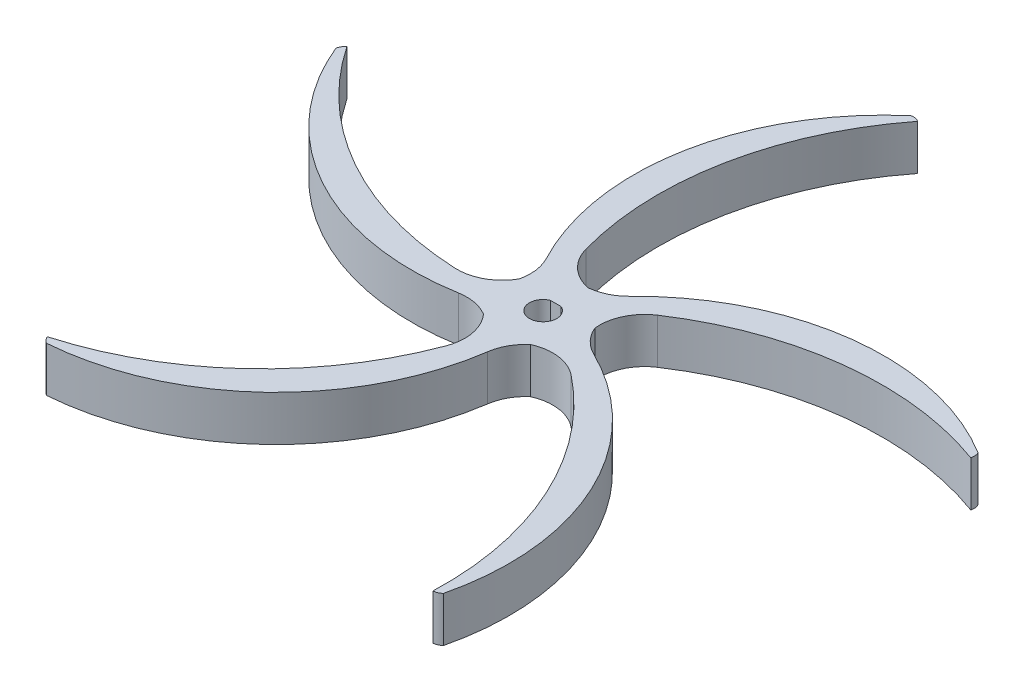
from build123d import *

# Parameters (mm, degrees)
BOSS_EXTRUDE4_DEPTH = 10
SKETCH5_R           = 1.6210620194390177
BOSS_EXTRUDE8_DEPTH = 10
CIRPATTERN4_COUNT   = 5
SKETCH6_R           = 9.321133181207394
BOSS_EXTRUDE9_DEPTH = 10
CUT_EXTRUDE1_DEPTH  = 10
FILLET1_R           = 10


with BuildPart() as part:
    # Sketch3 → Boss-Extrude4 (new body)
    with BuildSketch(Plane(origin=(0, 0, 0), x_dir=(1, 0, 0), z_dir=(0, 1, 0))):
        with BuildLine():
            ThreePointArc((-2.568584889231257, 0), (-15.859987880186992, 40.28882096120527), (3.4054490784254314, 78.086882111293))
            ThreePointArc((3.4054490784254314, 78.086882111293), (4.310285634950187, 78.05431633363062), (5.144295315107662, 77.70187119279029))
            ThreePointArc((5.144295315107662, 77.70187119279029), (-9.176823691930053, 42.2861657946719), (-2.568584889231257, 4.660405757344381))
            ThreePointArc((-2.568584889231257, 4.660405757344381), (-2.7066052458532077, 2.3302028786721882), (-2.568584889231257, 0))
        make_face()
    extrude(amount=BOSS_EXTRUDE4_DEPTH)


with BuildPart() as body_2:
    # Sketch5 → Boss-Extrude8 (new body)
    with BuildSketch(Plane(origin=(0, 0, 0), x_dir=(1, 0, 0), z_dir=(0, 1, 0))):
        with Locations(Location((0, 0, 0), (0, 0, 270))):
            Circle(SKETCH5_R)
    extrude(amount=BOSS_EXTRUDE8_DEPTH)


with BuildPart() as cirpattern4_1:
    # CirPattern4: pattern copy
    add(part.part.rotate(Axis((-3.4e-16, 0, -5.8e-16), (0, 1, 0)), 1 * 360 / CIRPATTERN4_COUNT))


with BuildPart() as cirpattern4_2:
    # CirPattern4: pattern copy
    add(part.part.rotate(Axis((-3.4e-16, 0, -5.8e-16), (0, 1, 0)), 2 * 360 / CIRPATTERN4_COUNT))


with BuildPart() as cirpattern4_3:
    # CirPattern4: pattern copy
    add(part.part.rotate(Axis((-3.4e-16, 0, -5.8e-16), (0, 1, 0)), 3 * 360 / CIRPATTERN4_COUNT))


with BuildPart() as cirpattern4_4:
    # CirPattern4: pattern copy
    add(part.part.rotate(Axis((-3.4e-16, 0, -5.8e-16), (0, 1, 0)), 4 * 360 / CIRPATTERN4_COUNT))


with BuildPart() as part_1:
    add(part.part)

    add(body_2.part)  # Boss-Extrude9 merges body 2

    add(cirpattern4_1.part)  # Boss-Extrude9 merges CirPattern4_1

    add(cirpattern4_2.part)  # Boss-Extrude9 merges CirPattern4_2

    add(cirpattern4_3.part)  # Boss-Extrude9 merges CirPattern4_3

    add(cirpattern4_4.part)  # Boss-Extrude9 merges CirPattern4_4
    # Sketch6 → Boss-Extrude9 (add)
    with BuildSketch(Plane(origin=(0, 10, 0), x_dir=(1, 0, 0), z_dir=(0, 1, 0))):
        Circle(SKETCH6_R)
    extrude(amount=-BOSS_EXTRUDE9_DEPTH)

    # Sketch7 → Cut-Extrude1 (cut)
    with BuildSketch(Plane(origin=(0, 10, 0), x_dir=(1, 0, 0), z_dir=(0, 1, 0))):
        with BuildLine():
            Line((1.1925707526180573, 2.78), (-1.1925707526180573, 2.78))
            ThreePointArc((-1.1925707526180578, 2.78), (-1.6647970556993392, -2.5256832270367577), (3.025, -7.4e-16))
            ThreePointArc((3.025, 0), (2.5256832270367577, 1.6647970556993388), (1.1925707526180576, 2.78))
        make_face()
    extrude(amount=-CUT_EXTRUDE1_DEPTH, mode=Mode.SUBTRACT)

    # Fillet1
    # the kernel refuses this fillet: 10 mm, written as the material it adds along each edge
    with BuildSketch(Plane(origin=(9.294704214468556, 10, 0.7014252257691618), x_dir=(0.9166930954116449, 0, 0.399592002953784), z_dir=(0, -1, 0))) as fillet1_piece_1:
        with BuildLine():
            CenterArc((5.437298438361188, -9.98977111966082), FILLET1_R, 92.59172373372462, 44.87729573930281)
            ThreePointArc((-1.9318208534579913, -3.2298834828033556), (-0.8012017224871335, -1.713455421939968), (0, 0))
            ThreePointArc((0, 0), (2.4925557778833074, -0.0563838885471548), (4.985111555766614, 2e-17))
        make_face()
    extrude(amount=10)
    with BuildSketch(Plane(origin=(6.60253368503394, 10, -6.579519186065028), x_dir=(0.46308073985482195, 0, 0.8863160995804548), z_dir=(0, -1, 0))) as fillet1_piece_2:
        with BuildLine():
            CenterArc((8.524117810925986, -9.546886996079968), FILLET1_R, 107.3138862206167, 66.77214806671216)
            ThreePointArc((-1.4226595103454045, -8.516537093842318), (-0.8440182810230222, -4.236103365094945), (0, 0))
            ThreePointArc((0, 0), (2.774027598326007, -0.42235266556755513), (5.548055196652016, 2e-17))
        make_face()
    extrude(amount=10)
    with BuildSketch(Plane(origin=(-4.2171994813875955, 10, -8.31256592851991), x_dir=(-0.3267162956046077, 0, -0.9451224588308135), z_dir=(0, -1, 0))) as fillet1_piece_3:
        with BuildLine():
            CenterArc((8.011945209416133, 9.980599667944867), FILLET1_R, 206.79739354469726, 66.7721480667119)
            ThreePointArc((-0.9141180755940358, 5.47223031395517), (-0.04047863659748981, 2.805703542850818), (0, 0))
            ThreePointArc((0, 0), (4.317272407237243, -0.13452709830263468), (8.634544814474475, -3.1e-16))
        make_face()
    extrude(amount=10)
    with BuildSketch(Plane(origin=(3.539316591620801, 10, -8.623036695160394), x_dir=(-0.9827141698360341, 0, -0.18512930725164625), z_dir=(0, -1, 0))) as fillet1_piece_4:
        with BuildLine():
            CenterArc((5.782329586263011, 9.794100565483701), FILLET1_R, 213.47572744282695, 44.87729573930915)
            ThreePointArc((-2.5588660900526423, 4.278263848410483), (-1.2310439268876425, 2.1680738683956533), (0, 0))
            ThreePointArc((0, 0), (1.881759756341037, 0.19192160510617215), (3.7635195126820715, -5e-17))
        make_face()
    extrude(amount=10)
    with BuildSketch(Plane(origin=(-9.208906301869895, 10, 1.4420709085153902), x_dir=(-0.9998257608489958, 0, 0.018666760370418967), z_dir=(0, -1, 0))) as fillet1_piece_5:
        with BuildLine():
            CenterArc((8.011945209416153, 9.980599667944865), FILLET1_R, 206.79739354469731, 66.7721480667119)
            ThreePointArc((-0.9141180755940117, 5.472230313955157), (-0.04047863659747148, 2.8057035428508104), (0, 0))
            ThreePointArc((0, 0), (4.317272407237252, -0.13452709830265147), (8.634544814474507, -2e-17))
        make_face()
    extrude(amount=10)
    with BuildSketch(Plane(origin=(-7.1072862639004715, 10, -6.030754989615849), x_dir=(-0.47974381311129005, 0, 0.8774086127805217), z_dir=(0, -1, 0))) as fillet1_piece_6:
        with BuildLine():
            CenterArc((5.782329586263038, 9.794100565483692), FILLET1_R, 213.47572744282687, 44.877295739309034)
            ThreePointArc((-2.5588660900526223, 4.278263848410486), (-1.2310439268876405, 2.168073868395652), (0, 0))
            ThreePointArc((0, 0), (1.8817597563410384, 0.19192160510617853), (3.763519512682072, -7e-17))
        make_face()
    extrude(amount=10)
    with BuildSketch(Plane(origin=(-7.931861070486542, 10, 4.895825133754791), x_dir=(-0.9764945790844407, 0, 0.21554196115536567), z_dir=(0, -1, 0))) as fillet1_piece_7:
        with BuildLine():
            CenterArc((5.43729843836118, -9.989771119660821), FILLET1_R, 92.59172373372459, 44.877295739302724)
            ThreePointArc((-1.9318208534579884, -3.2298834828033454), (-0.801201722487141, -1.7134554219399574), (0, 0))
            ThreePointArc((0, 0), (2.492555777883305, -0.05638388854715234), (4.985111555766614, 5e-17))
        make_face()
    extrude(amount=10)
    with BuildSketch(Plane(origin=(-1.4742176123811461, 10, 9.203814764169852), x_dir=(-0.8956037205130516, 0, -0.44485275744135816), z_dir=(0, -1, 0))) as fillet1_piece_8:
        with BuildLine():
            CenterArc((8.524117810925947, -9.546886996079973), FILLET1_R, 107.31388622061658, 66.77214806671205)
            ThreePointArc((-1.422659510345439, -8.516537093842285), (-0.8440182810230522, -4.236103365094935), (0, 0))
            ThreePointArc((0, 0), (2.774027598325997, -0.42235266556755147), (5.548055196651995, 2.3e-16))
        make_face()
    extrude(amount=10)
    with BuildSketch(Plane(origin=(2.2051265282976815, 10, 9.056541325252308), x_dir=(-0.0967608331602571, 0, 0.9953076615630632), z_dir=(0, -1, 0))) as fillet1_piece_9:
        with BuildLine():
            CenterArc((5.437298438361169, -9.989771119660823), FILLET1_R, 92.59172373372452, 44.87729573930274)
            ThreePointArc((-1.9318208534579957, -3.229883482803339), (-0.8012017224871391, -1.7134554219399516), (0, 0))
            ThreePointArc((0, 0), (2.4925557778833074, -0.05638388854715363), (4.985111555766614, 3e-17))
        make_face()
    extrude(amount=10)
    with BuildSketch(Plane(origin=(8.297789710604665, 10, 4.2461994418996625), x_dir=(-0.6998368836204316, 0, 0.7143026923681881), z_dir=(0, -1, 0))) as fillet1_piece_10:
        with BuildLine():
            CenterArc((8.52411781092599, -9.546886996079968), FILLET1_R, 107.3138862206167, 66.77214806671219)
            ThreePointArc((-1.4226595103454007, -8.516537093842324), (-0.8440182810230218, -4.236103365094961), (0, 0))
            ThreePointArc((0, 0), (2.774027598326008, -0.4223526655675579), (5.548055196652019, 1.7e-16))
        make_face()
    extrude(amount=10)


solid = part_1.part
